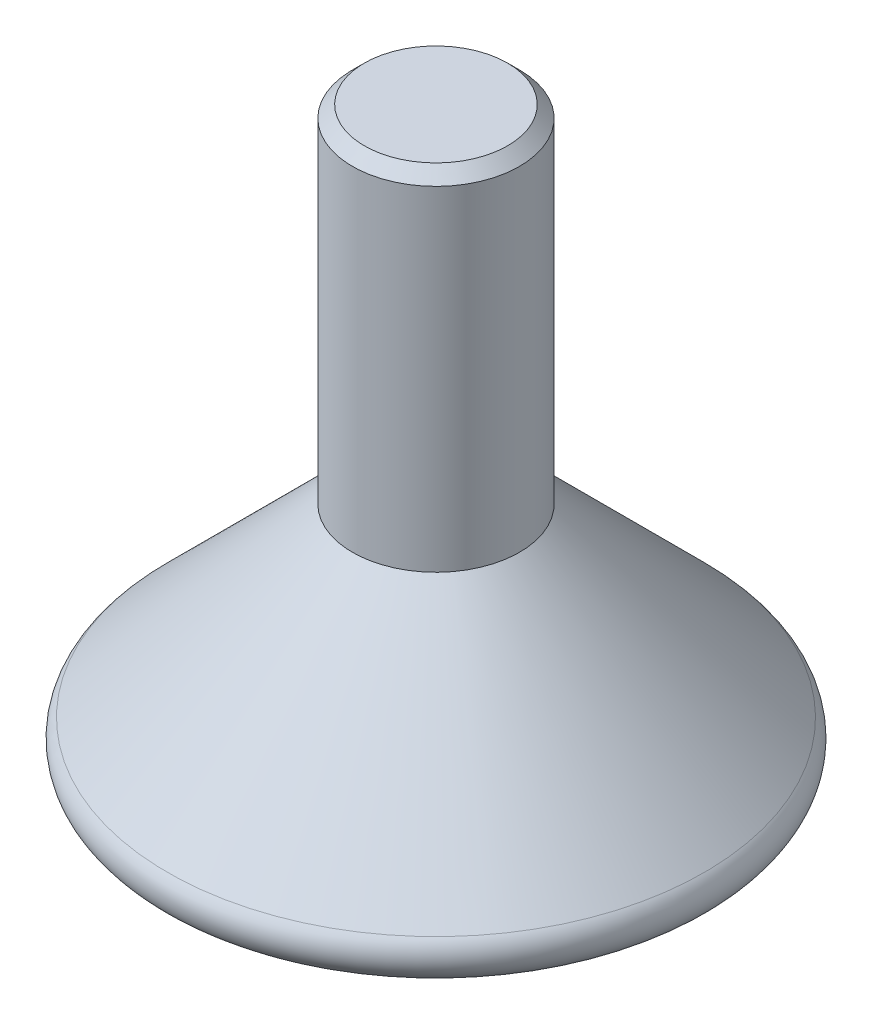
from build123d import *


with BuildPart() as part:
    # Croquis1 → Revolución2 (revolve)
    with BuildSketch(Plane.XY):
        with BuildLine():
            Line((-4.288289157, 34.333031186), (-5, 33.621320344))
            Line((-5, 33.621320344), (-5, 13.621320344))
            Line((-5, 13.621320344), (-16.060660172, 2.560660172))
            ThreePointArc((-16.060660172, 2.560660172), (-16.385819299, 0.925974851), (-15, 0))
            Line((-15, 0), (0, 0))
            Line((0, 0), (0, 34.333031186))
            Line((0, 34.333031186), (-4.288289157, 34.333031186))
        make_face()
    revolve(axis=Axis((0, 0, 0), (0, 1, 0)))


solid = part.part
